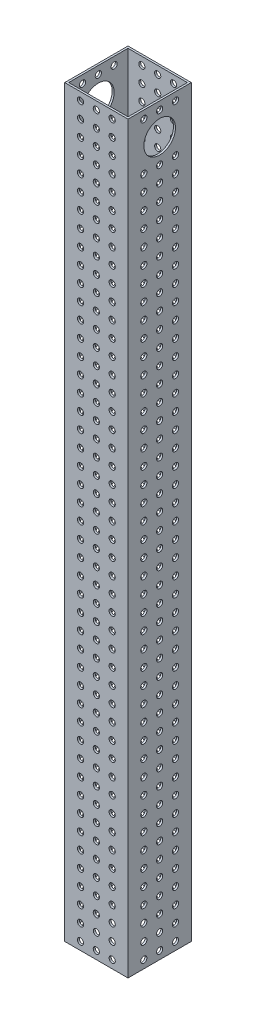
from build123d import *

# Parameters (mm, degrees)
SKETCH1_W           = 50.8
SKETCH1_H           = 50.8
SKETCH1_W_2         = 47.625
SKETCH1_H_2         = 47.625
BOSS_EXTRUDE1_DEPTH = 685.8
SKETCH2_R           = 2.4892
CUT_EXTRUDE1_DEPTH  = 689.147832955
SKETCH4_R           = 2.4892
CUT_EXTRUDE2_DEPTH  = 689.147832955
SKETCH5_W           = 50.8
SKETCH5_H           = 76.2
CUT_EXTRUDE3_DEPTH  = 689.147832955
SKETCH6_R           = 12.7
CUT_EXTRUDE4_DEPTH  = 613.240116294
CUT_EXTRUDE5_DEPTH  = 613.240116294


with BuildPart() as part:
    # Sketch1 → Boss-Extrude1 (new body)
    with BuildSketch(Plane(origin=(0, 0, 0), x_dir=(1, 0, 0), z_dir=(0, 1, 0))):
        Rectangle(SKETCH1_W, SKETCH1_H)
        Rectangle(SKETCH1_W_2, SKETCH1_H_2, mode=Mode.SUBTRACT)
    extrude(amount=BOSS_EXTRUDE1_DEPTH)

    # Sketch2 → Cut-Extrude1 (cut, through all)
    with BuildSketch(Plane.XY.offset(25.4)):
        with Locations((-12.7, 679.45)):
            Circle(SKETCH2_R)
        with Locations((-12.7, 666.75)):
            Circle(SKETCH2_R)
        with Locations((-12.7, 654.05)):
            Circle(SKETCH2_R)
        with Locations((-12.7, 641.35)):
            Circle(SKETCH2_R)
        with Locations((-12.7, 628.65)):
            Circle(SKETCH2_R)
        with Locations((-12.7, 615.95)):
            Circle(SKETCH2_R)
        with Locations((-12.7, 603.25)):
            Circle(SKETCH2_R)
        with Locations((-12.7, 590.55)):
            Circle(SKETCH2_R)
        with Locations((-12.7, 577.85)):
            Circle(SKETCH2_R)
        with Locations((-12.7, 565.15)):
            Circle(SKETCH2_R)
        with Locations((-12.7, 552.45)):
            Circle(SKETCH2_R)
        with Locations((-12.7, 539.75)):
            Circle(SKETCH2_R)
        with Locations((-12.7, 527.05)):
            Circle(SKETCH2_R)
        with Locations((-12.7, 514.35)):
            Circle(SKETCH2_R)
        with Locations((-12.7, 501.65)):
            Circle(SKETCH2_R)
        with Locations((-12.7, 488.95)):
            Circle(SKETCH2_R)
        with Locations((-12.7, 476.25)):
            Circle(SKETCH2_R)
        with Locations((-12.7, 463.55)):
            Circle(SKETCH2_R)
        with Locations((-12.7, 450.85)):
            Circle(SKETCH2_R)
        with Locations((-12.7, 438.15)):
            Circle(SKETCH2_R)
        with Locations((-12.7, 425.45)):
            Circle(SKETCH2_R)
        with Locations((-12.7, 412.75)):
            Circle(SKETCH2_R)
        with Locations((-12.7, 400.05)):
            Circle(SKETCH2_R)
        with Locations((-12.7, 387.35)):
            Circle(SKETCH2_R)
        with Locations((-12.7, 374.65)):
            Circle(SKETCH2_R)
        with Locations((-12.7, 361.95)):
            Circle(SKETCH2_R)
        with Locations((-12.7, 349.25)):
            Circle(SKETCH2_R)
        with Locations((-12.7, 336.55)):
            Circle(SKETCH2_R)
        with Locations((-12.7, 323.85)):
            Circle(SKETCH2_R)
        with Locations((-12.7, 311.15)):
            Circle(SKETCH2_R)
        with Locations((-12.7, 298.45)):
            Circle(SKETCH2_R)
        with Locations((-12.7, 285.75)):
            Circle(SKETCH2_R)
        with Locations((-12.7, 273.05)):
            Circle(SKETCH2_R)
        with Locations((-12.7, 260.35)):
            Circle(SKETCH2_R)
        with Locations((-12.7, 247.65)):
            Circle(SKETCH2_R)
        with Locations((-12.7, 234.95)):
            Circle(SKETCH2_R)
        with Locations((-12.7, 222.25)):
            Circle(SKETCH2_R)
        with Locations((-12.7, 209.55)):
            Circle(SKETCH2_R)
        with Locations((-12.7, 196.85)):
            Circle(SKETCH2_R)
        with Locations((-12.7, 184.15)):
            Circle(SKETCH2_R)
        with Locations((-12.7, 171.45)):
            Circle(SKETCH2_R)
        with Locations((-12.7, 158.75)):
            Circle(SKETCH2_R)
        with Locations((-12.7, 146.05)):
            Circle(SKETCH2_R)
        with Locations((-12.7, 133.35)):
            Circle(SKETCH2_R)
        with Locations((-12.7, 120.65)):
            Circle(SKETCH2_R)
        with Locations((-12.7, 107.95)):
            Circle(SKETCH2_R)
        with Locations((-12.7, 95.25)):
            Circle(SKETCH2_R)
        with Locations((-12.7, 82.55)):
            Circle(SKETCH2_R)
        with Locations((-12.7, 69.85)):
            Circle(SKETCH2_R)
        with Locations((-12.7, 57.15)):
            Circle(SKETCH2_R)
        with Locations((-12.7, 44.45)):
            Circle(SKETCH2_R)
        with Locations((-12.7, 31.75)):
            Circle(SKETCH2_R)
        with Locations((-12.7, 19.05)):
            Circle(SKETCH2_R)
        with Locations((-12.7, 6.35)):
            Circle(SKETCH2_R)
        with Locations((12.7, 6.35)):
            Circle(SKETCH2_R)
        with Locations((12.7, 19.05)):
            Circle(SKETCH2_R)
        with Locations((12.7, 31.75)):
            Circle(SKETCH2_R)
        with Locations((12.7, 44.45)):
            Circle(SKETCH2_R)
        with Locations((12.7, 57.15)):
            Circle(SKETCH2_R)
        with Locations((12.7, 69.85)):
            Circle(SKETCH2_R)
        with Locations((12.7, 82.55)):
            Circle(SKETCH2_R)
        with Locations((12.7, 95.25)):
            Circle(SKETCH2_R)
        with Locations((12.7, 107.95)):
            Circle(SKETCH2_R)
        with Locations((12.7, 120.65)):
            Circle(SKETCH2_R)
        with Locations((12.7, 133.35)):
            Circle(SKETCH2_R)
        with Locations((12.7, 146.05)):
            Circle(SKETCH2_R)
        with Locations((12.7, 158.75)):
            Circle(SKETCH2_R)
        with Locations((12.7, 171.45)):
            Circle(SKETCH2_R)
        with Locations((12.7, 184.15)):
            Circle(SKETCH2_R)
        with Locations((12.7, 196.85)):
            Circle(SKETCH2_R)
        with Locations((12.7, 209.55)):
            Circle(SKETCH2_R)
        with Locations((12.7, 222.25)):
            Circle(SKETCH2_R)
        with Locations((12.7, 234.95)):
            Circle(SKETCH2_R)
        with Locations((12.7, 247.65)):
            Circle(SKETCH2_R)
        with Locations((12.7, 260.35)):
            Circle(SKETCH2_R)
        with Locations((12.7, 273.05)):
            Circle(SKETCH2_R)
        with Locations((12.7, 285.75)):
            Circle(SKETCH2_R)
        with Locations((12.7, 298.45)):
            Circle(SKETCH2_R)
        with Locations((12.7, 311.15)):
            Circle(SKETCH2_R)
        with Locations((12.7, 323.85)):
            Circle(SKETCH2_R)
        with Locations((12.7, 336.55)):
            Circle(SKETCH2_R)
        with Locations((12.7, 374.65)):
            Circle(SKETCH2_R)
        with Locations((12.7, 361.95)):
            Circle(SKETCH2_R)
        with Locations((12.7, 349.25)):
            Circle(SKETCH2_R)
        with Locations((12.7, 387.35)):
            Circle(SKETCH2_R)
        with Locations((12.7, 400.05)):
            Circle(SKETCH2_R)
        with Locations((12.7, 412.75)):
            Circle(SKETCH2_R)
        with Locations((12.7, 425.45)):
            Circle(SKETCH2_R)
        with Locations((12.7, 438.15)):
            Circle(SKETCH2_R)
        with Locations((12.7, 450.85)):
            Circle(SKETCH2_R)
        with Locations((12.7, 463.55)):
            Circle(SKETCH2_R)
        with Locations((12.7, 476.25)):
            Circle(SKETCH2_R)
        with Locations((12.7, 488.95)):
            Circle(SKETCH2_R)
        with Locations((12.7, 501.65)):
            Circle(SKETCH2_R)
        with Locations((12.7, 514.35)):
            Circle(SKETCH2_R)
        with Locations((12.7, 527.05)):
            Circle(SKETCH2_R)
        with Locations((12.7, 539.75)):
            Circle(SKETCH2_R)
        with Locations((12.7, 552.45)):
            Circle(SKETCH2_R)
        with Locations((12.7, 565.15)):
            Circle(SKETCH2_R)
        with Locations((12.7, 577.85)):
            Circle(SKETCH2_R)
        with Locations((12.7, 590.55)):
            Circle(SKETCH2_R)
        with Locations((12.7, 603.25)):
            Circle(SKETCH2_R)
        with Locations((12.7, 615.95)):
            Circle(SKETCH2_R)
        with Locations((12.7, 628.65)):
            Circle(SKETCH2_R)
        with Locations((12.7, 641.35)):
            Circle(SKETCH2_R)
        with Locations((12.7, 654.05)):
            Circle(SKETCH2_R)
        with Locations((12.7, 666.75)):
            Circle(SKETCH2_R)
        with Locations((12.7, 679.45)):
            Circle(SKETCH2_R)
        with Locations((0, 6.35)):
            Circle(SKETCH2_R)
        with Locations((0, 19.05)):
            Circle(SKETCH2_R)
        with Locations((0, 31.75)):
            Circle(SKETCH2_R)
        with Locations((0, 44.45)):
            Circle(SKETCH2_R)
        with Locations((0, 57.15)):
            Circle(SKETCH2_R)
        with Locations((0, 69.85)):
            Circle(SKETCH2_R)
        with Locations((0, 82.55)):
            Circle(SKETCH2_R)
        with Locations((0, 95.25)):
            Circle(SKETCH2_R)
        with Locations((0, 107.95)):
            Circle(SKETCH2_R)
        with Locations((0, 120.65)):
            Circle(SKETCH2_R)
        with Locations((0, 133.35)):
            Circle(SKETCH2_R)
        with Locations((0, 146.05)):
            Circle(SKETCH2_R)
        with Locations((0, 158.75)):
            Circle(SKETCH2_R)
        with Locations((0, 171.45)):
            Circle(SKETCH2_R)
        with Locations((0, 184.15)):
            Circle(SKETCH2_R)
        with Locations((0, 196.85)):
            Circle(SKETCH2_R)
        with Locations((0, 209.55)):
            Circle(SKETCH2_R)
        with Locations((0, 222.25)):
            Circle(SKETCH2_R)
        with Locations((0, 234.95)):
            Circle(SKETCH2_R)
        with Locations((0, 247.65)):
            Circle(SKETCH2_R)
        with Locations((0, 260.35)):
            Circle(SKETCH2_R)
        with Locations((0, 273.05)):
            Circle(SKETCH2_R)
        with Locations((0, 285.75)):
            Circle(SKETCH2_R)
        with Locations((0, 298.45)):
            Circle(SKETCH2_R)
        with Locations((0, 311.15)):
            Circle(SKETCH2_R)
        with Locations((0, 323.85)):
            Circle(SKETCH2_R)
        with Locations((0, 336.55)):
            Circle(SKETCH2_R)
        with Locations((0, 349.25)):
            Circle(SKETCH2_R)
        with Locations((0, 361.95)):
            Circle(SKETCH2_R)
        with Locations((0, 374.65)):
            Circle(SKETCH2_R)
        with Locations((0, 387.35)):
            Circle(SKETCH2_R)
        with Locations((0, 400.05)):
            Circle(SKETCH2_R)
        with Locations((0, 412.75)):
            Circle(SKETCH2_R)
        with Locations((0, 425.45)):
            Circle(SKETCH2_R)
        with Locations((0, 438.15)):
            Circle(SKETCH2_R)
        with Locations((0, 450.85)):
            Circle(SKETCH2_R)
        with Locations((0, 463.55)):
            Circle(SKETCH2_R)
        with Locations((0, 476.25)):
            Circle(SKETCH2_R)
        with Locations((0, 488.95)):
            Circle(SKETCH2_R)
        with Locations((0, 501.65)):
            Circle(SKETCH2_R)
        with Locations((0, 514.35)):
            Circle(SKETCH2_R)
        with Locations((0, 527.05)):
            Circle(SKETCH2_R)
        with Locations((0, 539.75)):
            Circle(SKETCH2_R)
        with Locations((0, 552.45)):
            Circle(SKETCH2_R)
        with Locations((0, 565.15)):
            Circle(SKETCH2_R)
        with Locations((0, 577.85)):
            Circle(SKETCH2_R)
        with Locations((0, 590.55)):
            Circle(SKETCH2_R)
        with Locations((0, 603.25)):
            Circle(SKETCH2_R)
        with Locations((0, 615.95)):
            Circle(SKETCH2_R)
        with Locations((0, 628.65)):
            Circle(SKETCH2_R)
        with Locations((0, 641.35)):
            Circle(SKETCH2_R)
        with Locations((0, 654.05)):
            Circle(SKETCH2_R)
        with Locations((0, 666.75)):
            Circle(SKETCH2_R)
        with Locations((0, 679.45)):
            Circle(SKETCH2_R)
    extrude(amount=-CUT_EXTRUDE1_DEPTH, mode=Mode.SUBTRACT)

    # Sketch4 → Cut-Extrude2 (cut, through all)
    with BuildSketch(Plane(origin=(25.4, 0, 0), x_dir=(0, 0, -1), z_dir=(1, 0, 0))):
        with Locations((-12.7, 679.45)):
            Circle(SKETCH4_R)
        with Locations((-12.7, 666.75)):
            Circle(SKETCH4_R)
        with Locations((-12.7, 654.05)):
            Circle(SKETCH4_R)
        with Locations((-12.7, 641.35)):
            Circle(SKETCH4_R)
        with Locations((-12.7, 628.65)):
            Circle(SKETCH4_R)
        with Locations((-12.7, 615.95)):
            Circle(SKETCH4_R)
        with Locations((-12.7, 603.25)):
            Circle(SKETCH4_R)
        with Locations((-12.7, 590.55)):
            Circle(SKETCH4_R)
        with Locations((-12.7, 552.45)):
            Circle(SKETCH4_R)
        with Locations((-12.7, 539.75)):
            Circle(SKETCH4_R)
        with Locations((-12.7, 527.05)):
            Circle(SKETCH4_R)
        with Locations((-12.7, 514.35)):
            Circle(SKETCH4_R)
        with Locations((-12.7, 501.65)):
            Circle(SKETCH4_R)
        with Locations((-12.7, 488.95)):
            Circle(SKETCH4_R)
        with Locations((-12.7, 476.25)):
            Circle(SKETCH4_R)
        with Locations((-12.7, 463.55)):
            Circle(SKETCH4_R)
        with Locations((-12.7, 450.85)):
            Circle(SKETCH4_R)
        with Locations((-12.7, 438.15)):
            Circle(SKETCH4_R)
        with Locations((-12.7, 425.45)):
            Circle(SKETCH4_R)
        with Locations((-12.7, 412.75)):
            Circle(SKETCH4_R)
        with Locations((-12.7, 400.05)):
            Circle(SKETCH4_R)
        with Locations((-12.7, 387.35)):
            Circle(SKETCH4_R)
        with Locations((-12.7, 374.65)):
            Circle(SKETCH4_R)
        with Locations((-12.7, 361.95)):
            Circle(SKETCH4_R)
        with Locations((-12.7, 349.25)):
            Circle(SKETCH4_R)
        with Locations((-12.7, 336.55)):
            Circle(SKETCH4_R)
        with Locations((-12.7, 323.85)):
            Circle(SKETCH4_R)
        with Locations((-12.7, 311.15)):
            Circle(SKETCH4_R)
        with Locations((-12.7, 298.45)):
            Circle(SKETCH4_R)
        with Locations((-12.7, 285.75)):
            Circle(SKETCH4_R)
        with Locations((-12.7, 273.05)):
            Circle(SKETCH4_R)
        with Locations((-12.7, 260.35)):
            Circle(SKETCH4_R)
        with Locations((-12.7, 247.65)):
            Circle(SKETCH4_R)
        with Locations((-12.7, 234.95)):
            Circle(SKETCH4_R)
        with Locations((-12.7, 222.25)):
            Circle(SKETCH4_R)
        with Locations((-12.7, 209.55)):
            Circle(SKETCH4_R)
        with Locations((-12.7, 196.85)):
            Circle(SKETCH4_R)
        with Locations((-12.7, 184.15)):
            Circle(SKETCH4_R)
        with Locations((-12.7, 171.45)):
            Circle(SKETCH4_R)
        with Locations((-12.7, 158.75)):
            Circle(SKETCH4_R)
        with Locations((-12.7, 146.05)):
            Circle(SKETCH4_R)
        with Locations((-12.7, 133.35)):
            Circle(SKETCH4_R)
        with Locations((-12.7, 120.65)):
            Circle(SKETCH4_R)
        with Locations((-12.7, 107.95)):
            Circle(SKETCH4_R)
        with Locations((-12.7, 95.25)):
            Circle(SKETCH4_R)
        with Locations((-12.7, 82.55)):
            Circle(SKETCH4_R)
        with Locations((-12.7, 69.85)):
            Circle(SKETCH4_R)
        with Locations((-12.7, 57.15)):
            Circle(SKETCH4_R)
        with Locations((-12.7, 44.45)):
            Circle(SKETCH4_R)
        with Locations((-12.7, 31.75)):
            Circle(SKETCH4_R)
        with Locations((-12.7, 19.05)):
            Circle(SKETCH4_R)
        with Locations((-12.7, 6.35)):
            Circle(SKETCH4_R)
        with Locations((12.7, 273.05)):
            Circle(SKETCH4_R)
        with Locations((12.7, 285.75)):
            Circle(SKETCH4_R)
        with Locations((12.7, 298.45)):
            Circle(SKETCH4_R)
        with Locations((12.7, 311.15)):
            Circle(SKETCH4_R)
        with Locations((12.7, 323.85)):
            Circle(SKETCH4_R)
        with Locations((12.7, 336.55)):
            Circle(SKETCH4_R)
        with Locations((12.7, 349.25)):
            Circle(SKETCH4_R)
        with Locations((12.7, 361.95)):
            Circle(SKETCH4_R)
        with Locations((12.7, 374.65)):
            Circle(SKETCH4_R)
        with Locations((12.7, 387.35)):
            Circle(SKETCH4_R)
        with Locations((12.7, 400.05)):
            Circle(SKETCH4_R)
        with Locations((12.7, 412.75)):
            Circle(SKETCH4_R)
        with Locations((12.7, 425.45)):
            Circle(SKETCH4_R)
        with Locations((12.7, 438.15)):
            Circle(SKETCH4_R)
        with Locations((12.7, 450.85)):
            Circle(SKETCH4_R)
        with Locations((12.7, 463.55)):
            Circle(SKETCH4_R)
        with Locations((12.7, 476.25)):
            Circle(SKETCH4_R)
        with Locations((12.7, 488.95)):
            Circle(SKETCH4_R)
        with Locations((12.7, 501.65)):
            Circle(SKETCH4_R)
        with Locations((12.7, 514.35)):
            Circle(SKETCH4_R)
        with Locations((12.7, 527.05)):
            Circle(SKETCH4_R)
        with Locations((12.7, 539.75)):
            Circle(SKETCH4_R)
        with Locations((12.7, 552.45)):
            Circle(SKETCH4_R)
        with Locations((12.7, 590.55)):
            Circle(SKETCH4_R)
        with Locations((12.7, 603.25)):
            Circle(SKETCH4_R)
        with Locations((12.7, 615.95)):
            Circle(SKETCH4_R)
        with Locations((12.7, 628.65)):
            Circle(SKETCH4_R)
        with Locations((12.7, 641.35)):
            Circle(SKETCH4_R)
        with Locations((12.7, 654.05)):
            Circle(SKETCH4_R)
        with Locations((12.7, 666.75)):
            Circle(SKETCH4_R)
        with Locations((12.7, 19.05)):
            Circle(SKETCH4_R)
        with Locations((12.7, 31.75)):
            Circle(SKETCH4_R)
        with Locations((12.7, 44.45)):
            Circle(SKETCH4_R)
        with Locations((12.7, 57.15)):
            Circle(SKETCH4_R)
        with Locations((12.7, 69.85)):
            Circle(SKETCH4_R)
        with Locations((12.7, 82.55)):
            Circle(SKETCH4_R)
        with Locations((12.7, 95.25)):
            Circle(SKETCH4_R)
        with Locations((12.7, 107.95)):
            Circle(SKETCH4_R)
        with Locations((12.7, 120.65)):
            Circle(SKETCH4_R)
        with Locations((12.7, 133.35)):
            Circle(SKETCH4_R)
        with Locations((12.7, 146.05)):
            Circle(SKETCH4_R)
        with Locations((12.7, 158.75)):
            Circle(SKETCH4_R)
        with Locations((12.7, 171.45)):
            Circle(SKETCH4_R)
        with Locations((12.7, 184.15)):
            Circle(SKETCH4_R)
        with Locations((12.7, 196.85)):
            Circle(SKETCH4_R)
        with Locations((12.7, 209.55)):
            Circle(SKETCH4_R)
        with Locations((12.7, 222.25)):
            Circle(SKETCH4_R)
        with Locations((12.7, 234.95)):
            Circle(SKETCH4_R)
        with Locations((12.7, 247.65)):
            Circle(SKETCH4_R)
        with Locations((12.7, 260.35)):
            Circle(SKETCH4_R)
        with Locations((12.7, 6.35)):
            Circle(SKETCH4_R)
        with Locations((12.7, 679.45)):
            Circle(SKETCH4_R)
        with Locations((0, 6.35)):
            Circle(SKETCH4_R)
        with Locations((0, 19.05)):
            Circle(SKETCH4_R)
        with Locations((0, 31.75)):
            Circle(SKETCH4_R)
        with Locations((0, 44.45)):
            Circle(SKETCH4_R)
        with Locations((0, 57.15)):
            Circle(SKETCH4_R)
        with Locations((0, 69.85)):
            Circle(SKETCH4_R)
        with Locations((0, 82.55)):
            Circle(SKETCH4_R)
        with Locations((0, 95.25)):
            Circle(SKETCH4_R)
        with Locations((0, 107.95)):
            Circle(SKETCH4_R)
        with Locations((0, 120.65)):
            Circle(SKETCH4_R)
        with Locations((0, 133.35)):
            Circle(SKETCH4_R)
        with Locations((0, 146.05)):
            Circle(SKETCH4_R)
        with Locations((0, 158.75)):
            Circle(SKETCH4_R)
        with Locations((0, 171.45)):
            Circle(SKETCH4_R)
        with Locations((0, 184.15)):
            Circle(SKETCH4_R)
        with Locations((0, 196.85)):
            Circle(SKETCH4_R)
        with Locations((0, 209.55)):
            Circle(SKETCH4_R)
        with Locations((0, 222.25)):
            Circle(SKETCH4_R)
        with Locations((0, 234.95)):
            Circle(SKETCH4_R)
        with Locations((0, 247.65)):
            Circle(SKETCH4_R)
        with Locations((0, 260.35)):
            Circle(SKETCH4_R)
        with Locations((0, 273.05)):
            Circle(SKETCH4_R)
        with Locations((0, 285.75)):
            Circle(SKETCH4_R)
        with Locations((0, 298.45)):
            Circle(SKETCH4_R)
        with Locations((0, 311.15)):
            Circle(SKETCH4_R)
        with Locations((0, 323.85)):
            Circle(SKETCH4_R)
        with Locations((0, 336.55)):
            Circle(SKETCH4_R)
        with Locations((0, 349.25)):
            Circle(SKETCH4_R)
        with Locations((0, 361.95)):
            Circle(SKETCH4_R)
        with Locations((0, 374.65)):
            Circle(SKETCH4_R)
        with Locations((0, 387.35)):
            Circle(SKETCH4_R)
        with Locations((0, 400.05)):
            Circle(SKETCH4_R)
        with Locations((0, 412.75)):
            Circle(SKETCH4_R)
        with Locations((0, 425.45)):
            Circle(SKETCH4_R)
        with Locations((0, 438.15)):
            Circle(SKETCH4_R)
        with Locations((0, 450.85)):
            Circle(SKETCH4_R)
        with Locations((0, 463.55)):
            Circle(SKETCH4_R)
        with Locations((0, 476.25)):
            Circle(SKETCH4_R)
        with Locations((0, 488.95)):
            Circle(SKETCH4_R)
        with Locations((0, 501.65)):
            Circle(SKETCH4_R)
        with Locations((0, 514.35)):
            Circle(SKETCH4_R)
        with Locations((0, 527.05)):
            Circle(SKETCH4_R)
        with Locations((0, 539.75)):
            Circle(SKETCH4_R)
        with Locations((0, 552.45)):
            Circle(SKETCH4_R)
        with Locations((0, 590.55)):
            Circle(SKETCH4_R)
        with Locations((0, 603.25)):
            Circle(SKETCH4_R)
        with Locations((0, 615.95)):
            Circle(SKETCH4_R)
        with Locations((0, 628.65)):
            Circle(SKETCH4_R)
        with Locations((0, 641.35)):
            Circle(SKETCH4_R)
        with Locations((0, 654.05)):
            Circle(SKETCH4_R)
        with Locations((0, 666.75)):
            Circle(SKETCH4_R)
        with Locations((0, 679.45)):
            Circle(SKETCH4_R)
    extrude(amount=-CUT_EXTRUDE2_DEPTH, mode=Mode.SUBTRACT)

    # Sketch5 → Cut-Extrude3 (cut, through all)
    with BuildSketch(Plane(origin=(25.4, 0, 0), x_dir=(0, 0, -1), z_dir=(1, 0, 0))):
        with Locations((0, 647.7)):
            Rectangle(SKETCH5_W, SKETCH5_H)
    extrude(amount=-CUT_EXTRUDE3_DEPTH, mode=Mode.SUBTRACT)

    # Sketch6 → Cut-Extrude4 (cut, through all)
    with BuildSketch(Plane(origin=(25.4, 0, 0), x_dir=(0, 0, -1), z_dir=(1, 0, 0))):
        with Locations((0, 571.9064)):
            Circle(SKETCH6_R)
    extrude(amount=-CUT_EXTRUDE4_DEPTH, mode=Mode.SUBTRACT)

    # Sketch7 → Cut-Extrude5 (cut, through all)
    with BuildSketch(Plane(origin=(25.4, 0, 0), x_dir=(0, 0, -1), z_dir=(1, 0, 0))):
        Polygon((-12.700000002, 596.9), (25.4, 596.9), (25.4, 609.6), (-25.4, 609.6), (-25.4, 596.9), align=None)
    extrude(amount=-CUT_EXTRUDE5_DEPTH, mode=Mode.SUBTRACT)


solid = part.part
